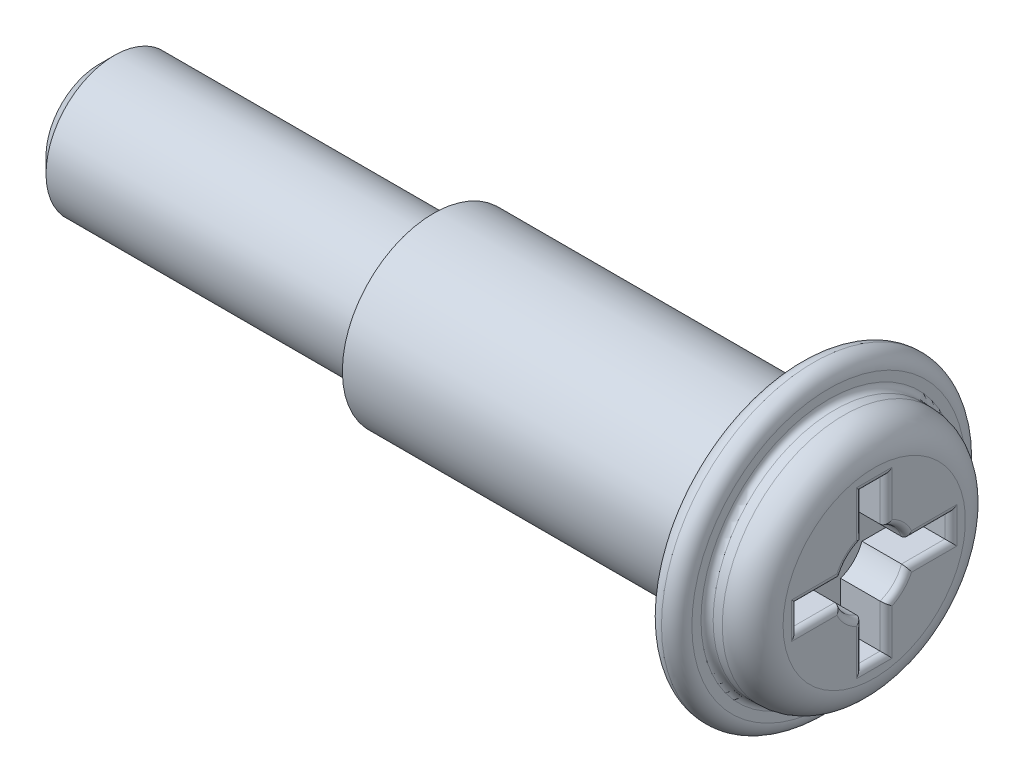
from build123d import *

# Parameters (mm, degrees)
CONG_1_R                     = 0.5
CONG_2_R                     = 0.2
ESQUISSE2_W                  = 0.783604582
ESQUISSE2_H                  = 2.520970871
ENL_V_MAT_EXTRU_1_DEPTH      = 1.5
R_P_TITION_CIRCULAIRE1_COUNT = 4
ESQUISSE3_R                  = 1.163963939
ENL_V_MAT_EXTRU_2_DEPTH      = 1.5
CONG_3_R                     = 0.2
CHANFREIN1_SIZE              = 0.5


with BuildPart() as part:
    # Esquisse1 → Révolution1 (revolve)
    with BuildSketch(Plane.XY, mode=Mode.PRIVATE) as r_volution1_sk:
        with BuildLine():
            Line((0, 0), (0, 2.25))
            Line((0, 2.25), (11, 2.25))
            Line((11, 2.25), (11, 3))
            Line((11, 3), (23, 3))
            Line((23, 3), (23, 5))
            Line((23, 5), (24, 5))
            Line((24, 5), (24, 4))
            Line((24, 4), (24.5, 4))
            ThreePointArc((24.5, 4), (25.207106781, 3.707106781), (25.5, 3))
            Line((25.5, 3), (25.5, 0))
            Line((25.5, 0), (0, 0))
        make_face()
    revolve(r_volution1_sk.sketch.rotate(Axis((0, 0, 0), (1, 0, 0)), 90), axis=Axis((0, 0, 0), (1, 0, 0)))

    # Congé1
    # the kernel refuses this fillet: 0.5 mm, written as the material it takes off along each edge
    with BuildSketch(Plane(origin=(23, 0, 0), x_dir=(0, 0, 1), z_dir=(0, 1, 0))) as cong_1_piece_1:
        with BuildLine():
            CenterArc((5 - CONG_1_R, CONG_1_R), CONG_1_R, 270, 90)
            Line((5, CONG_1_R), (5 + CONG_1_R * 0.02, CONG_1_R))
            Line((5 + CONG_1_R * 0.02, CONG_1_R), (5 + CONG_1_R * 0.02, -CONG_1_R * 0.02))
            Line((5 + CONG_1_R * 0.02, -CONG_1_R * 0.02), (5 - CONG_1_R, -CONG_1_R * 0.02))
            Line((5 - CONG_1_R, -CONG_1_R * 0.02), (5 - CONG_1_R, 0))
        make_face()
    revolve(axis=Axis((23, 0, 0), (1, 0, 0)), mode=Mode.SUBTRACT)
    with BuildSketch(Plane(origin=(24, 0, 0), x_dir=(0, 0, 1), z_dir=(0, 1, 0))) as cong_1_piece_2:
        with BuildLine():
            CenterArc((5 - CONG_1_R, -CONG_1_R), CONG_1_R, 0, 90)
            Line((5 - CONG_1_R, 0), (5 - CONG_1_R, CONG_1_R * 0.02))
            Line((5 - CONG_1_R, CONG_1_R * 0.02), (5 + CONG_1_R * 0.02, CONG_1_R * 0.02))
            Line((5 + CONG_1_R * 0.02, CONG_1_R * 0.02), (5 + CONG_1_R * 0.02, -CONG_1_R))
            Line((5 + CONG_1_R * 0.02, -CONG_1_R), (5, -CONG_1_R))
        make_face()
    revolve(axis=Axis((24, 0, 0), (1, 0, 0)), mode=Mode.SUBTRACT)

    # Congé2
    cong_2_edges = [part.edges().sort_by_distance(p)[0] for p in [
        (24, 0, -4),
    ]]
    fillet(cong_2_edges, radius=CONG_2_R)

    # Esquisse2 → Enlèv. mat.-Extru.1 (cut)
    with BuildSketch(Plane(origin=(25.5, 0, 0), x_dir=(0, 0, -1), z_dir=(1, 0, 0))):
        with Locations((0, 1.260485436)):
            Rectangle(ESQUISSE2_W, ESQUISSE2_H)
    enl_v_mat_extru_1 = extrude(amount=-ENL_V_MAT_EXTRU_1_DEPTH, mode=Mode.SUBTRACT)

    # Répétition circulaire1: Enlèv. mat.-Extru.1 ×4 about axis
    r_p_tition_circulaire1_axis = Axis((0, 0, 0), (1, 0, 0))
    for i in range(1, R_P_TITION_CIRCULAIRE1_COUNT):
        add(enl_v_mat_extru_1.rotate(r_p_tition_circulaire1_axis, i * 360 / R_P_TITION_CIRCULAIRE1_COUNT), mode=Mode.SUBTRACT)

    # Esquisse3 → Enlèv. mat.-Extru.2 (cut)
    with BuildSketch(Plane(origin=(25.5, 0, 0), x_dir=(0, 0, -1), z_dir=(1, 0, 0))):
        Circle(ESQUISSE3_R)
    extrude(amount=-ENL_V_MAT_EXTRU_2_DEPTH, mode=Mode.SUBTRACT)

    # Congé3
    cong_3_edges = [part.edges().sort_by_distance(p)[0] for p in [
        (25.5, 0, 2.520970871),
        (25.5, -0.391802291, 1.808505284),
        (25.5, -0.823046794, 0.823046794),
        (25.5, -1.808505284, 0.391802291),
        (25.5, -2.520970871, 0),
        (25.5, -1.808505284, -0.391802291),
        (25.5, -0.823046794, -0.823046794),
        (25.5, -0.391802291, -1.808505284),
        (25.5, 0, -2.520970871),
        (25.5, 0.391802291, -1.808505284),
        (25.5, 0.823046794, -0.823046794),
        (25.5, 1.808505284, -0.391802291),
        (25.5, 2.520970871, 0),
        (25.5, 1.808505284, 0.391802291),
        (25.5, 0.823046794, 0.823046794),
        (25.5, 0.391802291, 1.808505284),
    ]]
    fillet(cong_3_edges, radius=CONG_3_R)

    # Chanfrein1
    chanfrein1_edges = [part.edges().sort_by_distance(p)[0] for p in [
        (0, 0, -2.25),
    ]]
    chamfer(chanfrein1_edges, length=CHANFREIN1_SIZE)


solid = part.part
